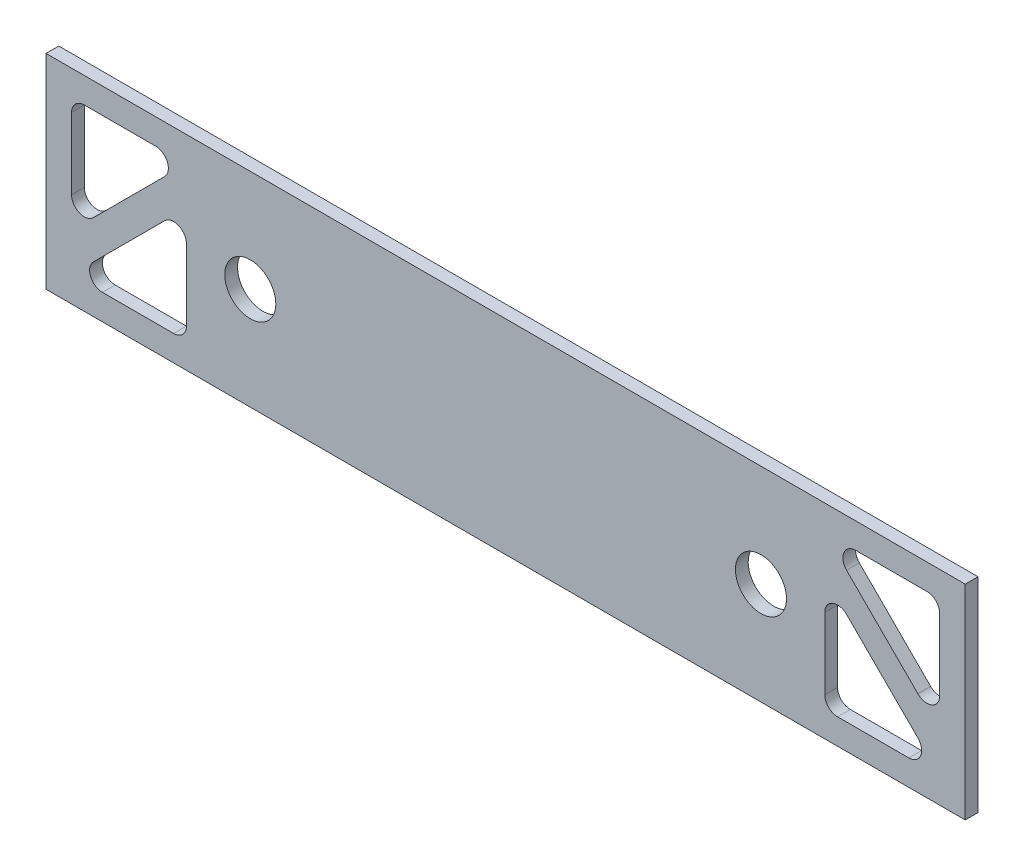
from build123d import *

# Parameters (mm, degrees)
SKETCH1_W           = 6.35
SKETCH1_H           = 101.6
BOSS_EXTRUDE1_DEPTH = 457.2
SKETCH2_R           = 12.7
CUT_EXTRUDE1_DEPTH  = 467.602190566
CUT_EXTRUDE2_DEPTH  = 467.602190566


with BuildPart() as part:
    # Sketch1 → Boss-Extrude1 (new body)
    with BuildSketch(Plane(origin=(0, 0, 0), x_dir=(0, 0, -1), z_dir=(1, 0, 0))):
        with Locations((1.913371748, -42.180867605)):
            Rectangle(SKETCH1_W, SKETCH1_H)
    extrude(amount=BOSS_EXTRUDE1_DEPTH)

    # Sketch2 → Cut-Extrude1 (cut, through all)
    with BuildSketch(Plane(origin=(0, 0, -5.088371748), x_dir=(-1, 0, 0), z_dir=(0, 0, -1))):
        with Locations((-355.6, -42.180867605)):
            Circle(SKETCH2_R)
        with Locations((-101.6, -42.180867605)):
            Circle(SKETCH2_R)
    extrude(amount=-CUT_EXTRUDE1_DEPTH, mode=Mode.SUBTRACT)

    # Sketch3 → Cut-Extrude2 (cut, through all)
    with BuildSketch(Plane(origin=(0, 0, -5.088371748), x_dir=(-1, 0, 0), z_dir=(0, 0, -1))):
        with BuildLine():
            Line((-438.15, -4.080867605), (-402.680256121, -4.080867605))
            ThreePointArc((-402.680256121, -4.080867605), (-396.81362109, -8.000827809), (-398.190128061, -14.920995665))
            Line((-398.190128061, -14.920995665), (-433.659871939, -50.390739544))
            ThreePointArc((-433.659871939, -50.390739544), (-440.580039796, -51.767246515), (-444.5, -45.900611484))
            Line((-444.5, -45.900611484), (-444.5, -10.430867605))
            ThreePointArc((-444.5, -10.430867605), (-442.640128061, -5.940739544), (-438.15, -4.080867605))
        make_face()
        with BuildLine():
            Line((-398.190128061, -33.970995665), (-433.659871939, -69.440739544))
            ThreePointArc((-433.659871939, -69.440739544), (-435.03637891, -76.3609074), (-429.169743879, -80.280867605))
            Line((-429.169743879, -80.280867605), (-393.7, -80.280867605))
            ThreePointArc((-393.7, -80.280867605), (-389.209871939, -78.420995665), (-387.35, -73.930867605))
            Line((-387.35, -73.930867605), (-387.35, -38.461123726))
            ThreePointArc((-387.35, -38.461123726), (-391.269960204, -32.594488694), (-398.190128061, -33.970995665))
        make_face()
        with BuildLine():
            Line((-69.85, -73.930867605), (-69.85, -38.461123726))
            ThreePointArc((-69.85, -38.461123726), (-65.930039796, -32.594488694), (-59.009871939, -33.970995665))
            Line((-59.009871939, -33.970995665), (-23.540128061, -69.440739544))
            ThreePointArc((-23.540128061, -69.440739544), (-22.16362109, -76.3609074), (-28.030256121, -80.280867605))
            Line((-28.030256121, -80.280867605), (-63.5, -80.280867605))
            ThreePointArc((-63.5, -80.280867605), (-67.990128061, -78.420995665), (-69.85, -73.930867605))
        make_face()
        with BuildLine():
            Line((-23.540128061, -50.390739544), (-59.009871939, -14.920995665))
            ThreePointArc((-59.009871939, -14.920995665), (-60.38637891, -8.000827809), (-54.519743879, -4.080867605))
            Line((-54.519743879, -4.080867605), (-19.05, -4.080867605))
            ThreePointArc((-19.05, -4.080867605), (-14.559871939, -5.940739544), (-12.7, -10.430867605))
            Line((-12.7, -10.430867605), (-12.7, -45.900611484))
            ThreePointArc((-12.7, -45.900611484), (-16.619960204, -51.767246515), (-23.540128061, -50.390739544))
        make_face()
    extrude(amount=-CUT_EXTRUDE2_DEPTH, mode=Mode.SUBTRACT)


solid = part.part
